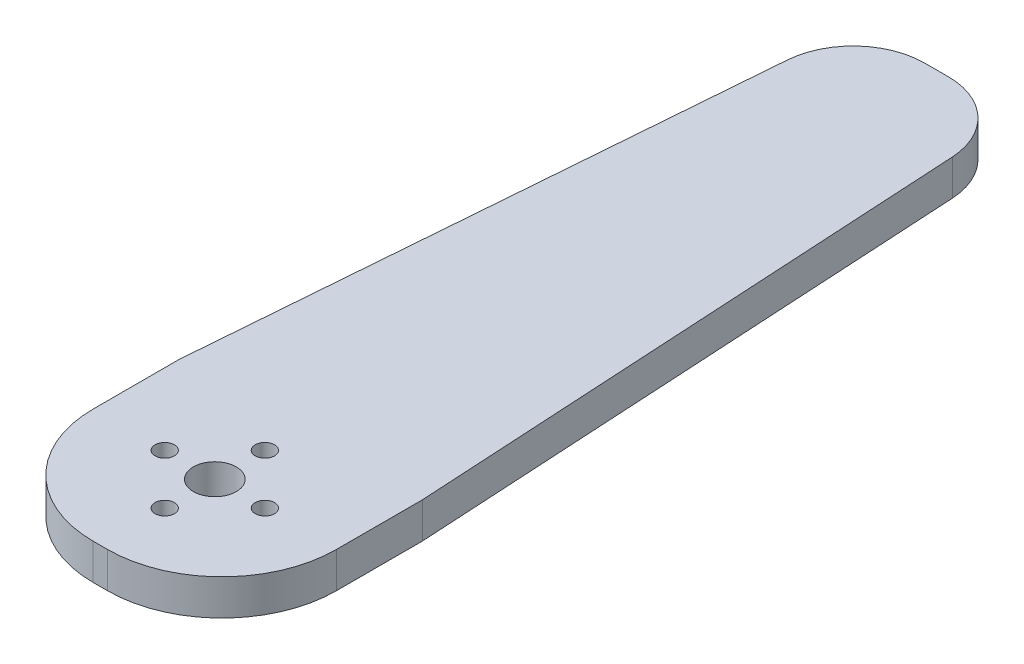
from build123d import *

# Parameters (mm, degrees)
BOSS_1_DEPTH = 5
S_HOLE2_R    = 3
HOLE_2_DEPTH = 5.2
S_HOLE3_R    = 1.35
HOLE_3_DEPTH = 5.2
S_HOLE4_R    = 1.35
HOLE_4_DEPTH = 5.2
S_HOLE5_R    = 1.35
HOLE_5_DEPTH = 5.2
S_HOLE6_R    = 1.35
HOLE_6_DEPTH = 5.2


with BuildPart() as part:
    # S_prism1 → Boss_1 (new body)
    with BuildSketch(Plane(origin=(0, 0, 0), x_dir=(1, 0, 0), z_dir=(0, 1, 0))):
        with BuildLine():
            Line((-1, -16), (1, -16))
            ThreePointArc((1, -16), (12.3137, -11.3137), (17, 0))
            Line((17, 0), (17, 12))
            Line((17, 12), (12.536, 90.5673))
            ThreePointArc((12.536, 90.5673), (9.419651018, 97.268851799), (2.5521, 100))
            Line((2.5521, 100), (-0.7639, 100))
            ThreePointArc((-0.7639, 100), (-7.548845635, 97.346057851), (-10.7324, 90.7929))
            Line((-10.7324, 90.7929), (-17, 12))
            Line((-17, 12), (-17, 0))
            ThreePointArc((-17, 0), (-12.3137, -11.3137), (-1, -16))
        make_face()
    extrude(amount=BOSS_1_DEPTH)

    # S_hole2 → Hole_2 (cut)
    with BuildSketch(Plane(origin=(0, -0.1, 0), x_dir=(1, 0, 0), z_dir=(0, 1, 0))):
        Circle(S_HOLE2_R)
    extrude(amount=HOLE_2_DEPTH, mode=Mode.SUBTRACT)

    # S_hole3 → Hole_3 (cut)
    with BuildSketch(Plane(origin=(0, -0.1, 0), x_dir=(1, 0, 0), z_dir=(0, 1, 0))):
        with Locations((7, 0)):
            Circle(S_HOLE3_R)
    extrude(amount=HOLE_3_DEPTH, mode=Mode.SUBTRACT)

    # S_hole4 → Hole_4 (cut)
    with BuildSketch(Plane(origin=(0, -0.1, 0), x_dir=(1, 0, 0), z_dir=(0, 1, 0))):
        with Locations((0, -7)):
            Circle(S_HOLE4_R)
    extrude(amount=HOLE_4_DEPTH, mode=Mode.SUBTRACT)

    # S_hole5 → Hole_5 (cut)
    with BuildSketch(Plane(origin=(0, -0.1, 0), x_dir=(1, 0, 0), z_dir=(0, 1, 0))):
        with Locations((-7, 0)):
            Circle(S_HOLE5_R)
    extrude(amount=HOLE_5_DEPTH, mode=Mode.SUBTRACT)

    # S_hole6 → Hole_6 (cut)
    with BuildSketch(Plane(origin=(0, -0.1, 0), x_dir=(1, 0, 0), z_dir=(0, 1, 0))):
        with Locations((0, 7)):
            Circle(S_HOLE6_R)
    extrude(amount=HOLE_6_DEPTH, mode=Mode.SUBTRACT)


solid = part.part
